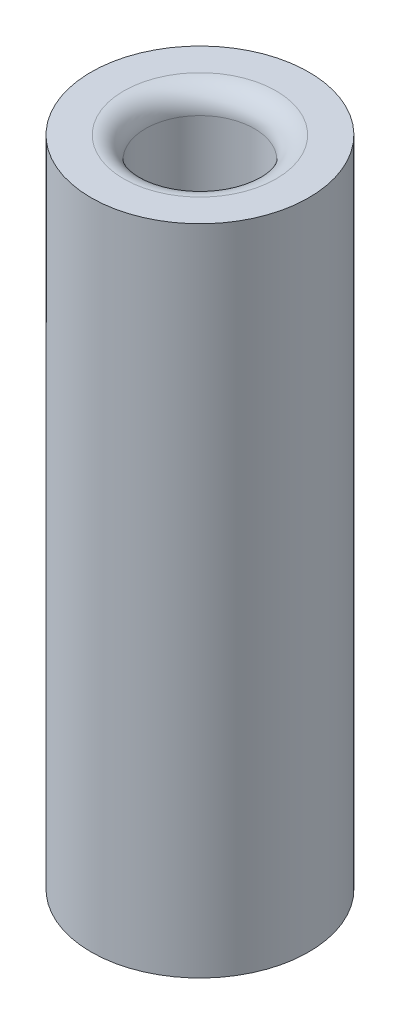
from build123d import *

# Parameters (mm, degrees)
SKETCH1_R           = 2.5
SKETCH1_R_2         = 1.25
BOSS_EXTRUDE1_DEPTH = 15
FILLET1_R           = 0.5


with BuildPart() as part:
    # Sketch1 → Boss-Extrude1 (new body)
    with BuildSketch(Plane(origin=(0, 0, 0), x_dir=(1, 0, 0), z_dir=(0, 1, 0))):
        Circle(SKETCH1_R)
        Circle(SKETCH1_R_2, mode=Mode.SUBTRACT)
    extrude(amount=BOSS_EXTRUDE1_DEPTH)

    # Fillet1
    fillet1_edges = [part.edges().sort_by_distance(p)[0] for p in [
        (-1.25, 0, 0),
        (-1.25, 15, 0),
    ]]
    fillet(fillet1_edges, radius=FILLET1_R)


solid = part.part
